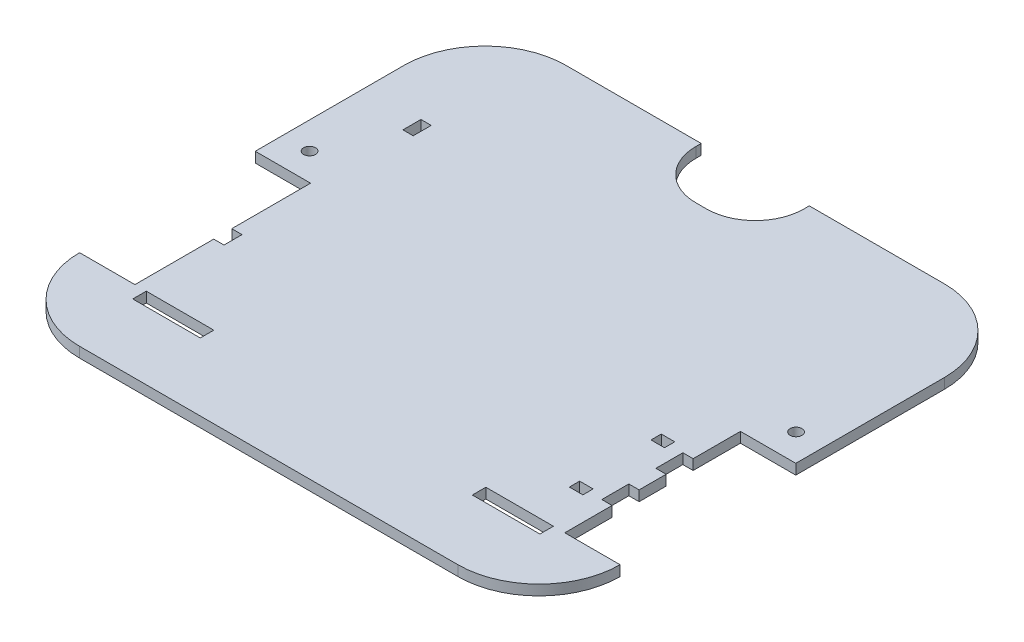
from build123d import *

# Parameters (mm, degrees)
SKETCH1_W           = 254
SKETCH1_H           = 228.6
BOSS_EXTRUDE1_DEPTH = 4.826
SKETCH2_W           = 26.00000007
SKETCH2_H           = 82.55
CUT_EXTRUDE1_DEPTH  = 4.826
CUT_EXTRUDE3_DEPTH  = 4.826
SKETCH7_W           = 50.8
SKETCH7_H           = 25.4
CUT_EXTRUDE5_DEPTH  = 4.826
FILLET9_R           = 22.86
FILLET10_R          = 22.86
CUT_EXTRUDE6_DEPTH  = 4.826
SKETCH9_W           = 31.75
SKETCH9_H           = 6.35
CUT_EXTRUDE7_DEPTH  = 171.929167423
SKETCH17_R          = 2.778125
CUT_EXTRUDE14_DEPTH = 171.929167423
SKETCH18_W          = 4.826
SKETCH18_H          = 12.7
CUT_EXTRUDE15_DEPTH = 171.929167423
SKETCH19_W          = 4.826
SKETCH19_H          = 8.466666666
CUT_EXTRUDE16_DEPTH = 171.929167423
SKETCH20_W          = 6.35
SKETCH20_H          = 4.826
CUT_EXTRUDE17_DEPTH = 4.826


with BuildPart() as part:
    # Sketch1 → Boss-Extrude1 (new body)
    with BuildSketch(Plane(origin=(0, 0, 0), x_dir=(1, 0, 0), z_dir=(0, 1, 0))):
        Rectangle(SKETCH1_W, SKETCH1_H)
    extrude(amount=BOSS_EXTRUDE1_DEPTH)

    # Sketch2 → Cut-Extrude1 (cut)
    with BuildSketch(Plane(origin=(0, 4.826, 0), x_dir=(1, 0, 0), z_dir=(0, 1, 0))):
        with Locations((-113.999999965, -34.925)):
            Rectangle(SKETCH2_W, SKETCH2_H)
        with Locations((113.999999965, -34.925)):
            Rectangle(SKETCH2_W, SKETCH2_H)
    extrude(amount=-CUT_EXTRUDE1_DEPTH, mode=Mode.SUBTRACT)

    # Sketch4 → Cut-Extrude3 (cut)
    with BuildSketch(Plane(origin=(0, 4.826, 0), x_dir=(1, 0, 0), z_dir=(0, 1, 0))):
        with BuildLine():
            Line((-127, 76.2), (-127, 114.3))
            Line((-127, 114.3), (-88.9, 114.3))
            ThreePointArc((-88.9, 114.3), (-115.840768363, 103.140768363), (-127, 76.2))
        make_face()
        with BuildLine():
            Line((127, 76.2), (127, 114.3))
            Line((127, 114.3), (88.9, 114.3))
            ThreePointArc((88.9, 114.3), (115.840768363, 103.140768363), (127, 76.2))
        make_face()
    extrude(amount=-CUT_EXTRUDE3_DEPTH, mode=Mode.SUBTRACT)

    # Sketch7 → Cut-Extrude5 (cut)
    with BuildSketch(Plane(origin=(0, 4.826, 0), x_dir=(1, 0, 0), z_dir=(0, 1, 0))):
        with Locations((0, 101.6)):
            Rectangle(SKETCH7_W, SKETCH7_H)
    extrude(amount=-CUT_EXTRUDE5_DEPTH, mode=Mode.SUBTRACT)

    # Fillet9
    fillet9_edges = [part.edges().sort_by_distance(p)[0] for p in [
        (-25.4, 2.413, -88.9),
    ]]
    fillet(fillet9_edges, radius=FILLET9_R)

    # Fillet10
    fillet10_edges = [part.edges().sort_by_distance(p)[0] for p in [
        (25.4, 2.413, -88.9),
    ]]
    fillet(fillet10_edges, radius=FILLET10_R)

    # Sketch8 → Cut-Extrude6 (cut)
    with BuildSketch(Plane(origin=(0, 4.826, 0), x_dir=(1, 0, 0), z_dir=(0, 1, 0))):
        with BuildLine():
            Line((-127, -76.2), (-127, -114.3))
            Line((-127, -114.3), (-88.9, -114.3))
            ThreePointArc((-88.9, -114.3), (-115.840768363, -103.140768363), (-127, -76.2))
        make_face()
        with BuildLine():
            Line((127, -114.3), (88.9, -114.3))
            ThreePointArc((88.9, -114.3), (115.840768363, -103.140768363), (127, -76.2))
            Line((127, -76.2), (127, -114.3))
        make_face()
    extrude(amount=-CUT_EXTRUDE6_DEPTH, mode=Mode.SUBTRACT)

    # Sketch9 → Cut-Extrude7 (cut, through all)
    with BuildSketch(Plane.XZ):
        with Locations((-79.79099993, 79.375)):
            Rectangle(SKETCH9_W, SKETCH9_H)
        with Locations((79.79099993, 79.375)):
            Rectangle(SKETCH9_W, SKETCH9_H)
    extrude(amount=-CUT_EXTRUDE7_DEPTH, mode=Mode.SUBTRACT)

    # Sketch17 → Cut-Extrude14 (cut, through all)
    with BuildSketch(Plane.XZ):
        with Locations((114.3, -19.164632523)):
            Circle(SKETCH17_R)
        with Locations((-114.3, -19.164632523)):
            Circle(SKETCH17_R)
    extrude(amount=-CUT_EXTRUDE14_DEPTH, mode=Mode.SUBTRACT)

    # Sketch18 → Cut-Extrude15 (cut, through all)
    with BuildSketch(Plane(origin=(0, 4.826, 0), x_dir=(1, 0, 0), z_dir=(0, 1, 0))):
        with Locations((98.58699993, -47.625)):
            Rectangle(SKETCH18_W, SKETCH18_H)
        with Locations((98.58699993, -22.225)):
            Rectangle(SKETCH18_W, SKETCH18_H)
    extrude(amount=-CUT_EXTRUDE15_DEPTH, mode=Mode.SUBTRACT)

    # Sketch19 → Cut-Extrude16 (cut, through all)
    with BuildSketch(Plane(origin=(0, 4.826, 0), x_dir=(1, 0, 0), z_dir=(0, 1, 0))):
        with Locations((-98.58699993, -34.925)):
            Rectangle(SKETCH19_W, SKETCH19_H)
        with Locations((-98.58699993, 53.975)):
            Rectangle(SKETCH19_W, SKETCH19_H)
    extrude(amount=-CUT_EXTRUDE16_DEPTH, mode=Mode.SUBTRACT)

    # Sketch20 → Cut-Extrude17 (cut)
    with BuildSketch(Plane.XZ):
        with Locations((86.64899993, 54.102)):
            Rectangle(SKETCH20_W, SKETCH20_H)
        with Locations((86.64899993, 15.748)):
            Rectangle(SKETCH20_W, SKETCH20_H)
    extrude(amount=-CUT_EXTRUDE17_DEPTH, mode=Mode.SUBTRACT)


solid = part.part
